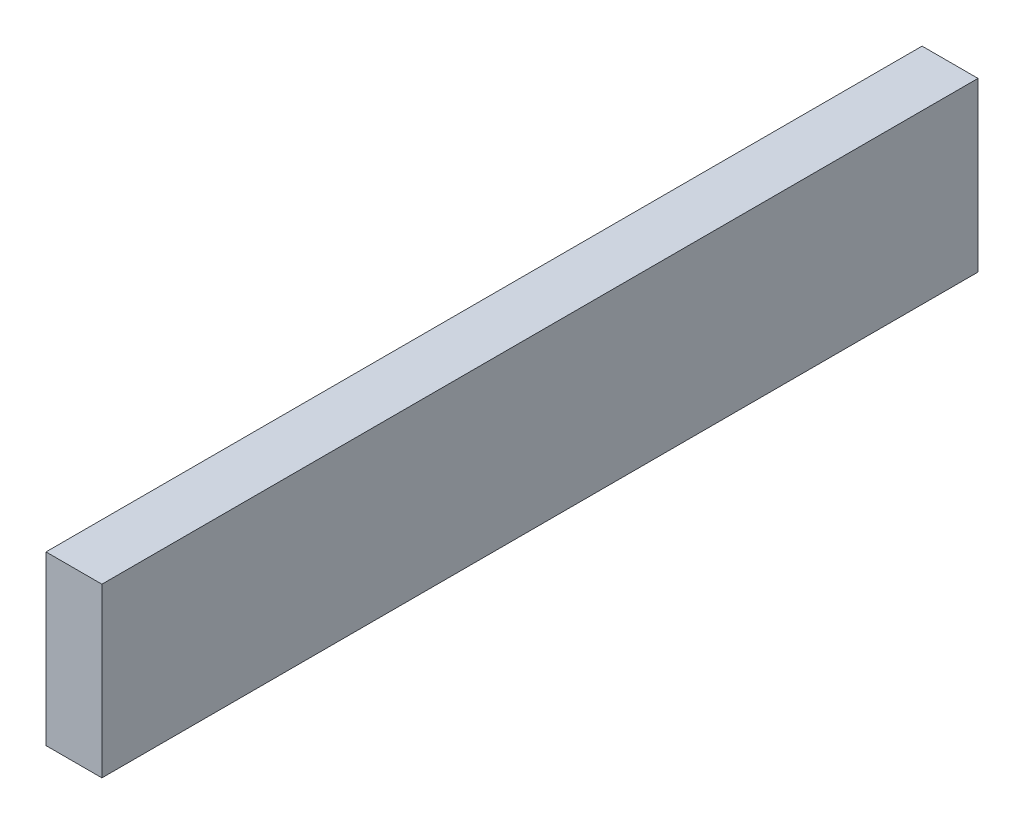
from build123d import *

# Parameters (mm, degrees)
SKETCH1_W           = 30
SKETCH1_H           = 90
BOSS_EXTRUDE1_DEPTH = 235


with BuildPart() as part:
    # Sketch1 → Boss-Extrude1 (new, symmetric)
    with BuildSketch(Plane.XY):
        Rectangle(SKETCH1_W, SKETCH1_H)
    extrude(amount=BOSS_EXTRUDE1_DEPTH, both=True)


solid = part.part
